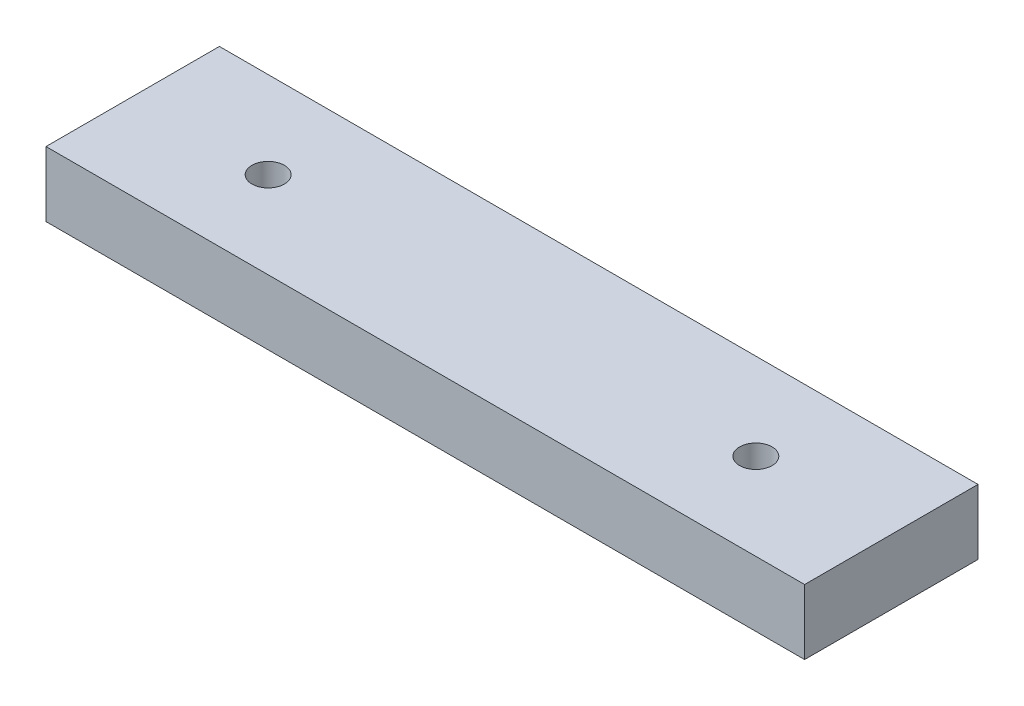
from build123d import *

# Parameters (mm, degrees)
SKETCH_1_W      = 70
SKETCH_1_H      = 16
SKETCH_1_R      = 1.5
EXTRUDE_1_DEPTH = 6


with BuildPart() as part:
    # 草圖1 → 填料-伸長1 (new body)
    with BuildSketch(Plane(origin=(0, 0, 0), x_dir=(1, 0, 0), z_dir=(0, 1, 0))):
        Rectangle(SKETCH_1_W, SKETCH_1_H)
        with Locations((-22.5, 0)):
            Circle(SKETCH_1_R, mode=Mode.SUBTRACT)
        with Locations((22.5, 0)):
            Circle(SKETCH_1_R, mode=Mode.SUBTRACT)
    extrude(amount=EXTRUDE_1_DEPTH)


solid = part.part
